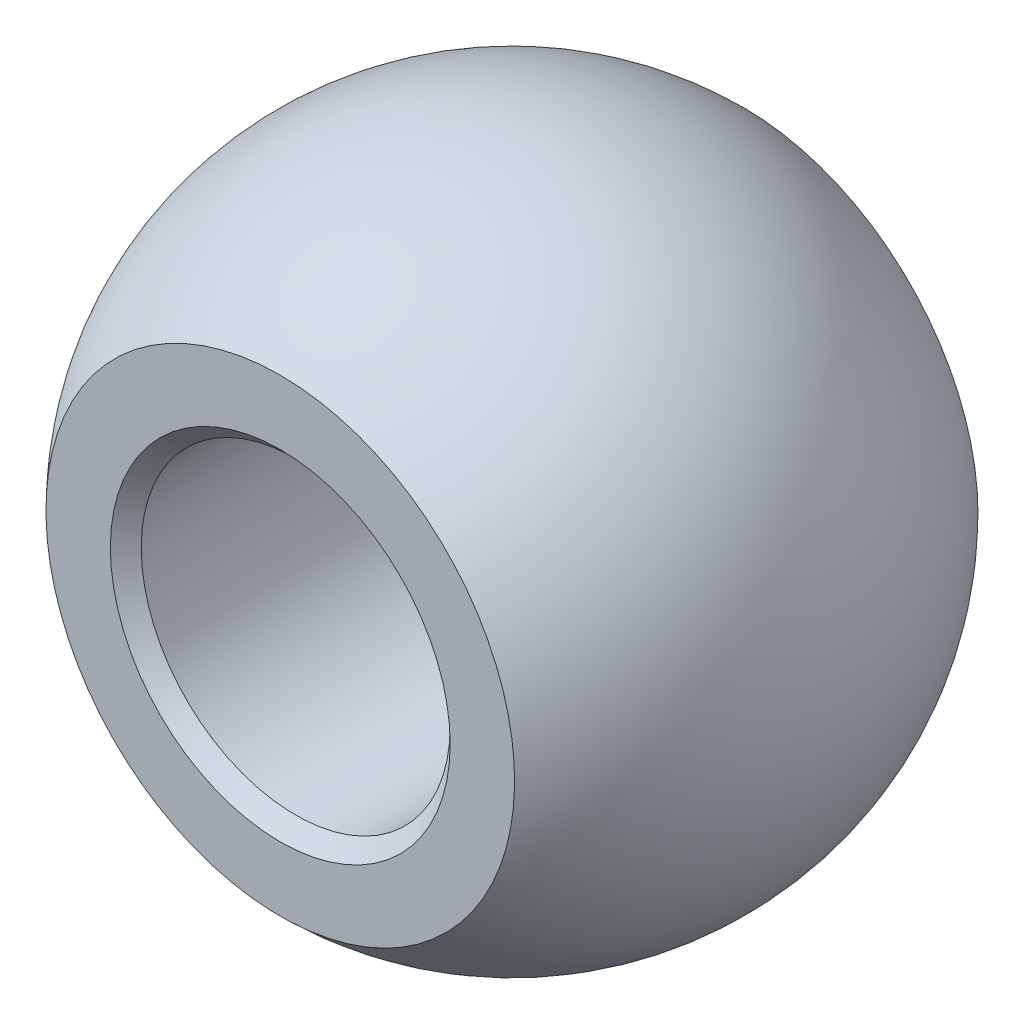
from build123d import *

# Parameters (mm, degrees)
CUT_EXTRUDE_1_DEPTH      = 12.085125168
CUT_EXTRUDE_1_DEPTH_BACK = 12.085125168
SKETCH_2_W               = 5.665320751
SKETCH_2_H               = 15.857476742
SKETCH_2_W_2             = 5.827961538
SKETCH_2_H_2             = 17.104389443
SKETCH_3_R               = 3
CUT_EXTRUDE_2_DEPTH      = 15.167921513
CHAMFER_1_SIZE           = 0.3


with BuildPart() as part:
    # Эскиз1 → Повернуть1 (revolve)
    with BuildSketch(Plane.XY):
        with BuildLine():
            Line((0, 6.4), (0, 3))
            Line((0, 3), (0, -3))
            Line((0, -3), (0, -6.4))
            ThreePointArc((0, -6.4), (-6.4, 0), (0, 6.4))
        make_face()
    revolve(axis=Axis((0, 6.4, 0), (0, -1, 0)))

    # Эскиз2 → Вырез-Вытянуть1 (cut, two sides: drawn at the far end of the back side and taken through both)
    with BuildSketch(Plane(origin=(0, 0, 0), x_dir=(0, 0, -1), z_dir=(1, 0, 0)).offset(-CUT_EXTRUDE_1_DEPTH_BACK)):
        with Locations((7.332660376, -0.020460734)):
            Rectangle(SKETCH_2_W, SKETCH_2_H)
        with Locations((-7.413980769, -0.101781127)):
            Rectangle(SKETCH_2_W_2, SKETCH_2_H_2)
    extrude(amount=CUT_EXTRUDE_1_DEPTH + CUT_EXTRUDE_1_DEPTH_BACK, mode=Mode.SUBTRACT)

    # Эскиз3 → Вырез-Вытянуть2 (cut, through all)
    with BuildSketch(Plane.XY.offset(4.5)):
        Circle(SKETCH_3_R)
    extrude(amount=-CUT_EXTRUDE_2_DEPTH, mode=Mode.SUBTRACT)

    # Фаска1
    chamfer_1_edges = [part.edges().sort_by_distance(p)[0] for p in [
        (-3, 0, 4.5),
        (-3, 0, -4.5),
    ]]
    chamfer(chamfer_1_edges, length=CHAMFER_1_SIZE)


solid = part.part
